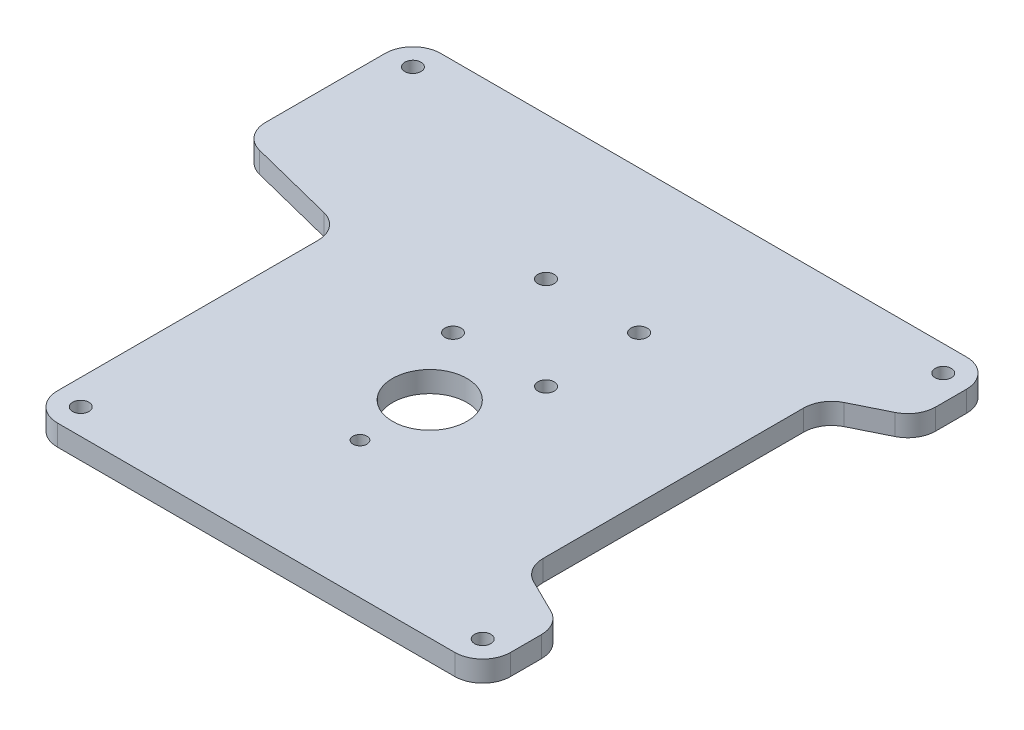
from build123d import *

# Parameters (mm, degrees)
SKETCH1_R           = 1.75
SKETCH1_R_2         = 1.5
SKETCH1_R_3         = 8
BOSS_EXTRUDE1_DEPTH = 4.5


with BuildPart() as part:
    # Sketch1 → Boss-Extrude1 (new body)
    with BuildSketch(Plane(origin=(0, 0, 0), x_dir=(1, 0, 0), z_dir=(0, 1, 0))):
        with BuildLine():
            Line((-35.7, -55), (49.7, -55))
            ThreePointArc((49.7, -55), (53.942640687, -53.242640687), (55.7, -49))
            Line((55.7, -49), (55.7, -42.377818725))
            ThreePointArc((55.7, -42.377818725), (54.797249664, -39.212689049), (52.36065138, -37))
            Line((52.36065138, -37), (45.03934862, -33.377818725))
            ThreePointArc((45.03934862, -33.377818725), (42.602750336, -31.165129675), (41.7, -28))
            Line((41.7, -28), (41.7, 28))
            ThreePointArc((41.7, 28), (42.602750336, 31.165129675), (45.03934862, 33.377818725))
            Line((45.03934862, 33.377818725), (52.36065138, 37))
            ThreePointArc((52.36065138, 37), (54.797249664, 39.212689049), (55.7, 42.377818725))
            Line((55.7, 42.377818725), (55.7, 49))
            ThreePointArc((55.7, 49), (53.942640687, 53.242640687), (49.7, 55))
            Line((49.7, 55), (-63.3, 55))
            ThreePointArc((-63.3, 55), (-67.542640687, 53.242640687), (-69.3, 49))
            Line((-69.3, 49), (-69.3, 23.31729281))
            ThreePointArc((-69.3, 23.31729281), (-68.03372658, 19.630582533), (-64.769389112, 17.5))
            Line((-64.769389112, 17.5), (-46.230610888, 12.81729281))
            ThreePointArc((-46.230610888, 12.81729281), (-42.96627342, 10.686710277), (-41.7, 7))
            Line((-41.7, 7), (-41.7, -49))
            ThreePointArc((-41.7, -49), (-39.942640687, -53.242640687), (-35.7, -55))
        make_face()
        with Locations((-63.8, 49.5)):
            Circle(SKETCH1_R, mode=Mode.SUBTRACT)
        with Locations((-36.2, -49.5)):
            Circle(SKETCH1_R, mode=Mode.SUBTRACT)
        with Locations((50.2, -49.5)):
            Circle(SKETCH1_R, mode=Mode.SUBTRACT)
        with Locations((50.2, 49.5)):
            Circle(SKETCH1_R, mode=Mode.SUBTRACT)
        with Locations((-10, 24.318057397)):
            Circle(SKETCH1_R, mode=Mode.SUBTRACT)
        with Locations((-10, 4.318057397)):
            Circle(SKETCH1_R, mode=Mode.SUBTRACT)
        with Locations((10, 4.318057397)):
            Circle(SKETCH1_R, mode=Mode.SUBTRACT)
        with Locations((10, 24.318057397)):
            Circle(SKETCH1_R, mode=Mode.SUBTRACT)
        with Locations((0, -25.681942603)):
            Circle(SKETCH1_R_2, mode=Mode.SUBTRACT)
        with Locations((0, -10.681942603)):
            Circle(SKETCH1_R_3, mode=Mode.SUBTRACT)
    extrude(amount=BOSS_EXTRUDE1_DEPTH)


solid = part.part
